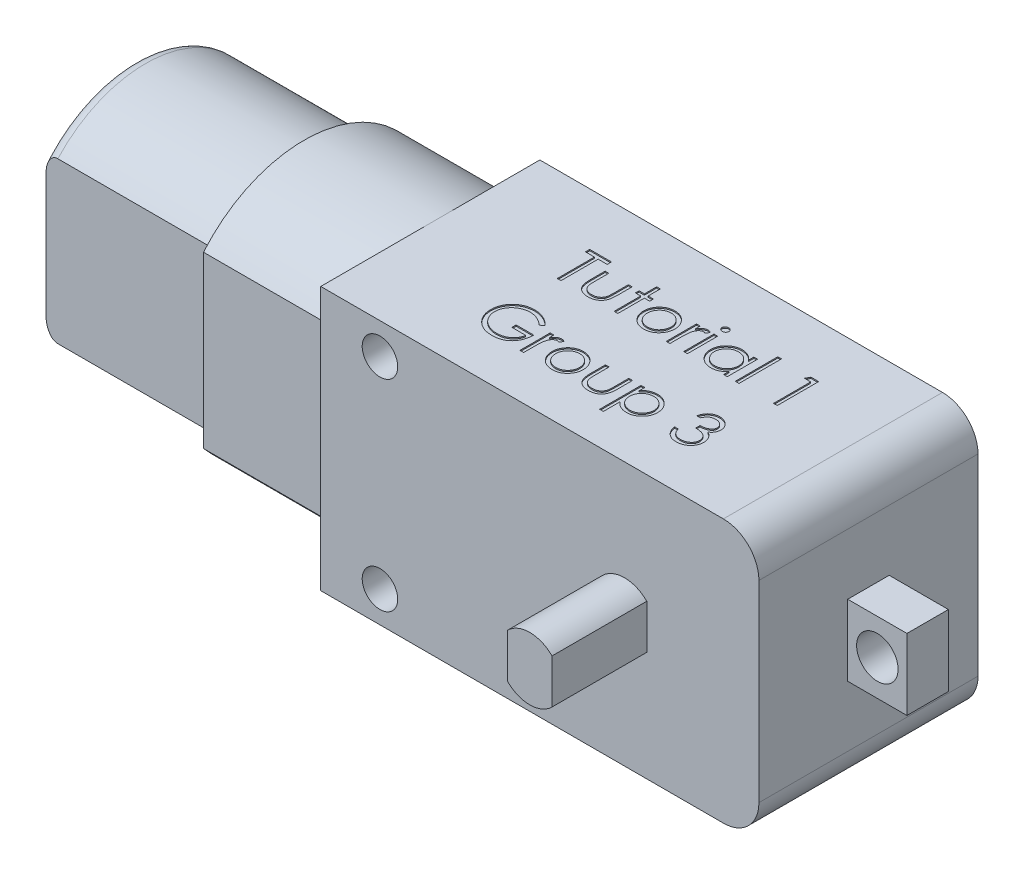
from build123d import *

# Parameters (mm, degrees)
BOSS_EXTRUDE3_DEPTH       = 9.25
BOSS_EXTRUDE3_DEPTH_BACK  = 9.25
BOSS_EXTRUDE4_DEPTH       = 11.4
BOSS_EXTRUDE5_DEPTH       = 8.8
BOSS_EXTRUDE6_DEPTH       = 5.6
FILLET1_R                 = 1
BOSS_EXTRUDE7_DEPTH       = 1
SKETCH11_R                = 1
BOSS_EXTRUDE8_DEPTH       = 1
SKETCH12_R                = 1.5
CUT_EXTRUDE1_DEPTH        = 30
BOSS_EXTRUDE11_DEPTH      = 8
BOSS_EXTRUDE11_DEPTH_BACK = 26.5
SKETCH13_R                = 2.65
SKETCH15_W                = 0.77
SKETCH15_H                = 3.735291154
CUT_EXTRUDE3_DEPTH        = 8
SKETCH16_W                = 0.77
SKETCH16_H                = 3.735291154
CUT_EXTRUDE4_DEPTH        = 8
SKETCH17_W                = 3.5
SKETCH17_H                = 6
BOSS_EXTRUDE12_DEPTH      = 5
SKETCH18_R                = 1.75
CUT_EXTRUDE5_DEPTH        = 5
SKETCH19_W                = 0.314102564
SKETCH19_H                = 2.557692308
SKETCH19_H_2              = 3.58974359
CUT_EXTRUDE6_DEPTH        = 0.1


with BuildPart() as part:
    # Sketch2 → Boss-Extrude3 (new, two sides: drawn at the far end of the back side and taken through both)
    with BuildSketch(Plane.XY.offset(-BOSS_EXTRUDE3_DEPTH_BACK)):
        with BuildLine():
            Line((-18.5, 11.125), (15.5, 11.125))
            ThreePointArc((15.5, 11.125), (17.621320344, 10.246320344), (18.5, 8.125))
            Line((18.5, 8.125), (18.5, -8.125))
            ThreePointArc((18.5, -8.125), (17.621320344, -10.246320344), (15.5, -11.125))
            Line((15.5, -11.125), (-18.5, -11.125))
            Line((-18.5, -11.125), (-18.5, 11.125))
        make_face()
    extrude(amount=BOSS_EXTRUDE3_DEPTH + BOSS_EXTRUDE3_DEPTH_BACK)

    # Sketch7 → Boss-Extrude4 (add)
    with BuildSketch(Plane.ZY.offset(18.5)):
        with BuildLine():
            Line((7.75, -7.17743861), (7.75, 7.17743861))
            ThreePointArc((7.75, 7.17743861), (-0.75, 11.125), (-9.25, 7.17743861))
            Line((-9.25, 7.17743861), (-9.25, -7.17743861))
            ThreePointArc((-9.25, -7.17743861), (-0.75, -11.125), (7.75, -7.17743861))
        make_face()
    extrude(amount=BOSS_EXTRUDE4_DEPTH)

    # Sketch8 → Boss-Extrude5 (add)
    with BuildSketch(Plane.ZY.offset(29.9)):
        with BuildLine():
            Line((6.65, -6.763181574), (6.65, 6.763181574))
            ThreePointArc((6.65, 6.763181574), (-0.75, 10.025), (-8.15, 6.763181574))
            Line((-8.15, 6.763181574), (-8.15, -6.763181574))
            ThreePointArc((-8.15, -6.763181574), (-0.75, -10.025), (6.65, -6.763181574))
        make_face()
    extrude(amount=BOSS_EXTRUDE5_DEPTH)

    # Sketch9 → Boss-Extrude6 (add)
    with BuildSketch(Plane.ZY.offset(38.7)):
        with BuildLine():
            Line((-8.15, 6.763181574), (-8.15, -6.763181574))
            ThreePointArc((-8.15, -6.763181574), (-0.75, -10.025), (6.65, -6.763181574))
            Line((6.65, -6.763181574), (6.65, 6.763181574))
            ThreePointArc((6.65, 6.763181574), (-0.75, 10.025), (-8.15, 6.763181574))
        make_face()
    extrude(amount=BOSS_EXTRUDE6_DEPTH)

    # Fillet1
    fillet1_edges = [part.edges().sort_by_distance(p)[0] for p in [
        (-44.3, -10.025, -0.75),
        (-44.3, 10.025, -0.75),
    ]]
    fillet(fillet1_edges, radius=FILLET1_R)

    # Sketch10 → Boss-Extrude7 (add)
    with BuildSketch(Plane.ZY.offset(44.3)):
        with BuildLine():
            Line((2.65, 3.666060556), (2.65, -3.666060556))
            ThreePointArc((2.65, -3.666060556), (-5.75, 0), (2.65, 3.666060556))
        make_face()
    extrude(amount=BOSS_EXTRUDE7_DEPTH)

    # Sketch11 → Boss-Extrude8 (add)
    with BuildSketch(Plane.ZY.offset(45.3)):
        with Locations((-0.75, 0)):
            Circle(SKETCH11_R)
    extrude(amount=BOSS_EXTRUDE8_DEPTH)

    # Sketch12 → Cut-Extrude1 (cut)
    with BuildSketch(Plane.XY.offset(9.25)):
        with Locations((-13.5, 8.5)):
            Circle(SKETCH12_R)
        with Locations((-13.5, -8.5)):
            Circle(SKETCH12_R)
    extrude(amount=-CUT_EXTRUDE1_DEPTH, mode=Mode.SUBTRACT)

    # Sketch13 → Boss-Extrude11 (add, two sides: drawn at the far end of the back side and taken through both)
    with BuildSketch(Plane.XY.offset(9.25).offset(-BOSS_EXTRUDE11_DEPTH_BACK)):
        with Locations((7.15, 0)):
            Circle(SKETCH13_R)
    extrude(amount=BOSS_EXTRUDE11_DEPTH + BOSS_EXTRUDE11_DEPTH_BACK)

    # Sketch15 → Cut-Extrude3 (cut)
    with BuildSketch(Plane.XY.offset(17.25)):
        with Locations((9.415, 0)):
            Rectangle(SKETCH15_W, SKETCH15_H)
        with Locations((4.885, 0)):
            Rectangle(SKETCH15_W, SKETCH15_H)
    extrude(amount=-CUT_EXTRUDE3_DEPTH, mode=Mode.SUBTRACT)

    # Sketch16 → Cut-Extrude4 (cut)
    with BuildSketch(Plane(origin=(0, 0, -17.25), x_dir=(-1, 0, 0), z_dir=(0, 0, -1))):
        with Locations((-4.885, 0)):
            Rectangle(SKETCH16_W, SKETCH16_H)
        with Locations((-9.415, 0)):
            Rectangle(SKETCH16_W, SKETCH16_H)
    extrude(amount=-CUT_EXTRUDE4_DEPTH, mode=Mode.SUBTRACT)

    # Sketch17 → Boss-Extrude12 (add)
    with BuildSketch(Plane(origin=(18.5, 0, 0), x_dir=(0, 0, -1), z_dir=(1, 0, 0))):
        Rectangle(SKETCH17_W, SKETCH17_H)
    extrude(amount=BOSS_EXTRUDE12_DEPTH)

    # Sketch18 → Cut-Extrude5 (cut)
    with BuildSketch(Plane.XY.offset(1.75)):
        with Locations((21, 0)):
            Circle(SKETCH18_R)
    extrude(amount=-CUT_EXTRUDE5_DEPTH, mode=Mode.SUBTRACT)

    # Sketch19 → Cut-Extrude6 (cut)
    # profile 1 of 16: a face of its own
    with BuildSketch(Plane(origin=(0, 11.125, 0), x_dir=(1, 0, 0), z_dir=(0, 1, 0))):
        Polygon((-9.857280915, 4.456208627), (-9.857280915, 4.815182986), (-8.017537325, 4.815182986), (-8.017537325, 4.456208627), (-8.780357838, 4.456208627), (-8.780357838, 1.315182986), (-9.094460402, 1.315182986), (-9.094460402, 4.456208627), align=None)
    # profile 2 of 16: a face of its own
    with BuildSketch(Plane(origin=(0, 11.125, 0), x_dir=(1, 0, 0), z_dir=(0, 1, 0))):
        with BuildLine():
            Line((-7.613691172, 3.872875294), (-7.299588607, 3.872875294))
            Line((-7.299588607, 3.872875294), (-7.299588607, 2.686577217))
            add(Edge.make_bspline(
                [(-7.299588607, 2.686577217), (-7.299446703, 2.651754468), (-7.299175245, 2.58514018), (-7.297334304, 2.489284993), (-7.293004211, 2.40186828), (-7.287590386, 2.322839544), (-7.28062825, 2.252212152), (-7.272344889, 2.190232795), (-7.263086468, 2.136198611), (-7.254023754, 2.103655255), (-7.24980896, 2.088520326)],
                knots=[0, 0, 0, 0, 1.388932606, 2.656963016, 3.823490214, 4.879454478, 5.816252168, 6.653371382, 7.373723809, 8, 8, 8, 8], degree=3))
            add(Edge.make_bspline(
                [(-7.24980896, 2.088520326), (-7.243047505, 2.069497455), (-7.229665164, 2.031847194), (-7.20539168, 1.977458189), (-7.175363344, 1.927082906), (-7.142503516, 1.878778834), (-7.104604108, 1.833976847), (-7.062144637, 1.792752603), (-7.0165464, 1.753548512), (-6.948791377, 1.70716372), (-6.856132111, 1.65744839), (-6.734479355, 1.614552571), (-6.602575129, 1.588916751), (-6.51141041, 1.585942496), (-6.46455255, 1.584413756)],
                knots=[0, 0, 0, 0, 0.725840625, 1.436591201, 2.137033971, 2.831655856, 3.53531722, 4.242432219, 4.957935707, 5.694543706, 7.190802206, 8.724350549, 10.316345118, 12, 12, 12, 12], degree=3))
            add(Edge.make_bspline(
                [(-6.46455255, 1.584413756), (-6.417699042, 1.585975004), (-6.327046174, 1.588995731), (-6.196591204, 1.61377927), (-6.07733979, 1.655184959), (-5.970488839, 1.712992371), (-5.876522999, 1.783734434), (-5.79821858, 1.866743242), (-5.733611325, 1.959392629), (-5.705401905, 2.028516908), (-5.69121521, 2.063279941)],
                knots=[0, 0, 0, 0, 1.157059328, 2.238695713, 3.266970494, 4.264342957, 5.228770407, 6.160125903, 7.074715775, 8, 8, 8, 8], degree=3))
            add(Edge.make_bspline(
                [(-5.69121521, 2.063279941), (-5.68702098, 2.07724624), (-5.677748562, 2.108122316), (-5.66778621, 2.160502064), (-5.658811749, 2.222966668), (-5.651148572, 2.295924877), (-5.64568341, 2.37918603), (-5.642737383, 2.472724106), (-5.639409108, 2.576245466), (-5.639358592, 2.648713225), (-5.639332197, 2.686577217)],
                knots=[0, 0, 0, 0, 0.557542046, 1.232589297, 2.036731608, 2.971723315, 4.038036528, 5.22795436, 6.551621927, 8, 8, 8, 8], degree=3))
            Line((-5.639332197, 2.686577217), (-5.639332197, 3.872875294))
            Line((-5.639332197, 3.872875294), (-5.325229633, 3.872875294))
            Line((-5.325229633, 3.872875294), (-5.325229633, 2.627682986))
            add(Edge.make_bspline(
                [(-5.325229633, 2.627682986), (-5.325671328, 2.585375815), (-5.326528276, 2.503294115), (-5.33203562, 2.384010003), (-5.341485232, 2.272847759), (-5.355827917, 2.169748539), (-5.372693592, 2.074791057), (-5.394449865, 1.987853611), (-5.420428103, 1.909204057), (-5.449733618, 1.83746228), (-5.484355485, 1.772415386), (-5.521182506, 1.710679569), (-5.563707278, 1.653786634), (-5.608477512, 1.598904497), (-5.658279168, 1.54876297), (-5.712179027, 1.502211494), (-5.769418447, 1.458538462), (-5.831267645, 1.419447183), (-5.896823707, 1.384230537), (-5.966167564, 1.353014459), (-6.040148563, 1.328311882), (-6.1178122, 1.307001216), (-6.199538979, 1.290286747), (-6.285250112, 1.27850018), (-6.374916728, 1.27127485), (-6.436026188, 1.270637805), (-6.467357037, 1.270311191)],
                knots=[0, 0, 0, 0, 1.493040784, 2.896703357, 4.213163133, 5.428574705, 6.569057535, 7.615249723, 8.588095153, 9.490268104, 10.346124644, 11.18633936, 12.024365274, 12.850166724, 13.684164916, 14.514361689, 15.362232829, 16.222528818, 17.093394965, 17.986930858, 18.902426812, 19.842810585, 20.827885679, 21.843828298, 22.894529745, 24, 24, 24, 24], degree=3))
            add(Edge.make_bspline(
                [(-6.467357037, 1.270311191), (-6.498453551, 1.270650899), (-6.559561096, 1.271318455), (-6.64923234, 1.278460262), (-6.735180947, 1.290268433), (-6.817101345, 1.307123651), (-6.895075743, 1.32816272), (-6.969419982, 1.353166256), (-7.039263545, 1.384246738), (-7.105445549, 1.419224295), (-7.167447938, 1.458789571), (-7.225556516, 1.50215761), (-7.279693368, 1.549263673), (-7.329870436, 1.59991103), (-7.375383413, 1.654727967), (-7.416799454, 1.713273527), (-7.45475616, 1.774967616), (-7.48910895, 1.841030778), (-7.518620706, 1.913602788), (-7.544675951, 1.993899885), (-7.56598659, 2.082802402), (-7.583329058, 2.18023433), (-7.597280499, 2.285729372), (-7.606966641, 2.399897787), (-7.612382472, 2.522461479), (-7.613245533, 2.607111369), (-7.613691172, 2.650820006)],
                knots=[0, 0, 0, 0, 1.083640291, 2.129454052, 3.13281866, 4.105697902, 5.042300162, 5.946461698, 6.836384745, 7.703652036, 8.553297018, 9.397182691, 10.228592656, 11.052265423, 11.879314572, 12.708807002, 13.549817954, 14.402308542, 15.300838682, 16.27712199, 17.341985831, 18.484375296, 19.725102775, 21.0496083, 22.476576903, 24, 24, 24, 24], degree=3))
            Line((-7.613691172, 2.650820006), (-7.613691172, 3.872875294))
        make_face()
    # profile 3 of 16: a face of its own
    with BuildSketch(Plane(origin=(0, 11.125, 0), x_dir=(1, 0, 0), z_dir=(0, 1, 0))):
        Polygon((-4.293178351, 4.904926576), (-3.979075787, 4.904926576), (-3.979075787, 3.872875294), (-3.530357838, 3.872875294), (-3.530357838, 3.55877273), (-3.979075787, 3.55877273), (-3.979075787, 1.315182986), (-4.293178351, 1.315182986), (-4.293178351, 3.55877273), (-4.7418963, 3.55877273), (-4.7418963, 3.872875294), (-4.293178351, 3.872875294), align=None)
    # profile 4 of 16: a face of its own
    with BuildSketch(Plane(origin=(0, 11.125, 0), x_dir=(1, 0, 0), z_dir=(0, 1, 0))):
        with BuildLine():
            add(Edge.make_bspline(
                [(-1.756519697, 3.917747089), (-1.708528424, 3.916725198), (-1.614429267, 3.914721519), (-1.476621381, 3.893306553), (-1.345076245, 3.860559189), (-1.219290053, 3.815287627), (-1.100873757, 3.754605676), (-0.988102513, 3.682196385), (-0.881285504, 3.596413792), (-0.817262475, 3.530055723), (-0.78476489, 3.49637289)],
                knots=[0, 0, 0, 0, 1.054011418, 2.066658804, 3.057071809, 4.030435133, 4.997543892, 5.974964718, 6.972108034, 8, 8, 8, 8], degree=3))
            add(Edge.make_bspline(
                [(-0.78476489, 3.49637289), (-0.756782935, 3.464158904), (-0.701360555, 3.400354362), (-0.630294836, 3.296898749), (-0.569073276, 3.189758649), (-0.520010315, 3.077511322), (-0.481325292, 2.961136651), (-0.453859595, 2.84023464), (-0.43752266, 2.715072292), (-0.435319693, 2.630068454), (-0.434203992, 2.587017922)],
                knots=[0, 0, 0, 0, 1.025258237, 2.030674902, 3.01204498, 3.988269485, 4.97094183, 5.956517959, 6.965070386, 8, 8, 8, 8], degree=3))
            add(Edge.make_bspline(
                [(-0.434203992, 2.587017922), (-0.435185329, 2.543717865), (-0.437124498, 2.458154931), (-0.455468114, 2.332135565), (-0.4839992, 2.209940743), (-0.524831038, 2.092082049), (-0.577189147, 1.978199222), (-0.641079835, 1.868789672), (-0.716951452, 1.763637539), (-0.802955449, 1.663635701), (-0.898007325, 1.571469486), (-1.001123473, 1.491141216), (-1.110277507, 1.422319692), (-1.22692086, 1.366883276), (-1.349988347, 1.323173576), (-1.479745415, 1.29247356), (-1.615990486, 1.273911876), (-1.709017707, 1.271528303), (-1.756519697, 1.270311191)],
                knots=[0, 0, 0, 0, 0.998656419, 1.973391657, 2.932242238, 3.890759089, 4.846373663, 5.82037756, 6.809684879, 7.83454468, 8.860553229, 9.859544525, 10.845671541, 11.83227036, 12.833544569, 13.85385346, 14.904124723, 16, 16, 16, 16], degree=3))
            add(Edge.make_bspline(
                [(-1.756519697, 1.270311191), (-1.804254417, 1.271532388), (-1.897745276, 1.273924162), (-2.034471258, 1.292401445), (-2.164460877, 1.323159427), (-2.287689476, 1.36702692), (-2.404834323, 1.422321464), (-2.51462082, 1.490933154), (-2.617820735, 1.571493309), (-2.71289272, 1.663629246), (-2.798891325, 1.763639202), (-2.874764333, 1.868789241), (-2.938654659, 1.978199334), (-2.991012863, 2.092082019), (-3.031844676, 2.209940751), (-3.060375769, 2.332135563), (-3.078719384, 2.458154932), (-3.080658552, 2.543717865), (-3.08163989, 2.587017922)],
                knots=[0, 0, 0, 0, 1.099876186, 2.154163076, 3.173186993, 4.173200201, 5.163417411, 6.152872554, 7.150605724, 8.17532212, 9.198891216, 10.186952605, 11.159729845, 12.11414092, 13.071450619, 14.029093627, 15.002601286, 16, 16, 16, 16], degree=3))
            add(Edge.make_bspline(
                [(-3.08163989, 2.587017922), (-3.080516579, 2.629834468), (-3.078292618, 2.714603871), (-3.061972109, 2.839530931), (-3.034613552, 2.96022832), (-2.995882156, 3.076153796), (-2.946366965, 3.187909232), (-2.886005677, 3.295314063), (-2.814215044, 3.398301864), (-2.759013093, 3.462023944), (-2.731078992, 3.494269525)],
                knots=[0, 0, 0, 0, 1.031353054, 2.041901799, 3.029428768, 4.008703097, 4.981709435, 5.96992636, 6.972712378, 8, 8, 8, 8], degree=3))
            add(Edge.make_bspline(
                [(-2.731078992, 3.494269525), (-2.698630401, 3.528244464), (-2.634814537, 3.59506216), (-2.527465809, 3.680594684), (-2.414971988, 3.754510758), (-2.295247062, 3.813986974), (-2.169564204, 3.860825491), (-2.037344962, 3.893391006), (-1.899069446, 3.914644361), (-1.804509825, 3.916702539), (-1.756519697, 3.917747089)],
                knots=[0, 0, 0, 0, 1.027980169, 2.021703884, 2.998553061, 3.971491411, 4.943284454, 5.930300938, 6.949603206, 8, 8, 8, 8], degree=3))
        make_face()
        with BuildLine():
            add(Edge.make_bspline(
                [(-1.757921941, 3.603644525), (-1.791859552, 3.602679933), (-1.858858681, 3.600775651), (-1.957478265, 3.586291746), (-2.052418419, 3.563344242), (-2.143859264, 3.530740186), (-2.231492436, 3.488641287), (-2.315401838, 3.436932926), (-2.395834278, 3.37629997), (-2.471216342, 3.306837298), (-2.540398654, 3.230958304), (-2.60087663, 3.150109945), (-2.652301737, 3.065603599), (-2.695141896, 2.977351387), (-2.727049084, 2.884458974), (-2.750222106, 2.787978342), (-2.764692347, 2.687712926), (-2.766578725, 2.619551908), (-2.767537325, 2.584914557)],
                knots=[0, 0, 0, 0, 1.021534396, 2.016698045, 2.994645724, 3.958388632, 4.93408049, 5.916473867, 6.921342795, 7.962252576, 8.998418191, 10.008913653, 10.997312074, 11.973003931, 12.956656626, 13.948281152, 14.957379055, 16, 16, 16, 16], degree=3))
            add(Edge.make_bspline(
                [(-2.767537325, 2.584914557), (-2.765930502, 2.54016253), (-2.762741257, 2.451338124), (-2.736806021, 2.320527002), (-2.693419741, 2.194945149), (-2.634832461, 2.075328763), (-2.561426243, 1.964656485), (-2.474939176, 1.865985001), (-2.376299476, 1.78079919), (-2.266682975, 1.710118344), (-2.148328657, 1.653958588), (-2.023072336, 1.614159613), (-1.892431642, 1.58828792), (-1.803150911, 1.585716446), (-1.757921941, 1.584413756)],
                knots=[0, 0, 0, 0, 1.016792936, 2.018143844, 3.017858371, 4.030088057, 5.03801393, 6.028138512, 7.003788237, 7.991172063, 8.984598303, 9.972568034, 10.972917682, 12, 12, 12, 12], degree=3))
            add(Edge.make_bspline(
                [(-1.757921941, 1.584413756), (-1.712695572, 1.585724036), (-1.623419976, 1.588310493), (-1.492960799, 1.614029312), (-1.368046827, 1.654132973), (-1.24981544, 1.710055183), (-1.140248836, 1.781067598), (-1.040899715, 1.865503975), (-0.955151104, 1.964917826), (-0.881817499, 2.075475355), (-0.822270756, 2.194759707), (-0.779087554, 2.320550179), (-0.753089968, 2.451332221), (-0.74990914, 2.540160552), (-0.748306556, 2.584914557)],
                knots=[0, 0, 0, 0, 1.02726834, 2.027799167, 3.010890988, 4.004497153, 4.992059811, 5.971914811, 6.958719428, 7.966827853, 8.981595046, 9.981490638, 10.983022906, 12, 12, 12, 12], degree=3))
            add(Edge.make_bspline(
                [(-0.748306556, 2.584914557), (-0.749264826, 2.619552115), (-0.751150555, 2.68771354), (-0.76562552, 2.787975994), (-0.788781059, 2.88446759), (-0.820752677, 2.977319594), (-0.86340669, 3.065832098), (-0.915823484, 3.149861825), (-0.976054509, 3.231238371), (-1.04607163, 3.306592012), (-1.121375008, 3.376327049), (-1.201840046, 3.436956438), (-1.285625024, 3.488414033), (-1.373003607, 3.531100274), (-1.464456175, 3.563047614), (-1.559263304, 3.586424246), (-1.657462114, 3.600714442), (-1.724221157, 3.602661584), (-1.757921941, 3.603644525)],
                knots=[0, 0, 0, 0, 1.042956736, 2.052379634, 3.044323526, 4.02829302, 5.004299113, 5.996692471, 7.007513377, 8.048758398, 9.090003419, 10.095195979, 11.07790575, 12.047570684, 13.018257071, 13.989683339, 14.985167495, 16, 16, 16, 16], degree=3))
        make_face(mode=Mode.SUBTRACT)
    # profile 5 of 16: a face of its own
    with BuildSketch(Plane(origin=(0, 11.125, 0), x_dir=(1, 0, 0), z_dir=(0, 1, 0))):
        with BuildLine():
            Line((0.104257546, 3.872875294), (0.41836011, 3.872875294))
            Line((0.41836011, 3.872875294), (0.41836011, 3.49637289))
            add(Edge.make_bspline(
                [(0.41836011, 3.49637289), (0.441548869, 3.531428718), (0.48589719, 3.598472718), (0.55961012, 3.687142019), (0.635113451, 3.760557065), (0.712768638, 3.819060584), (0.793146738, 3.862873703), (0.87448369, 3.894966738), (0.95805916, 3.913944053), (1.014221084, 3.916477712), (1.042358508, 3.917747089)],
                knots=[0, 0, 0, 0, 1.2804753, 2.448899062, 3.506932113, 4.484331642, 5.4025378, 6.288909075, 7.142734305, 8, 8, 8, 8], degree=3))
            add(Edge.make_bspline(
                [(1.042358508, 3.917747089), (1.064184834, 3.916556562), (1.10909392, 3.914106976), (1.177076509, 3.896896152), (1.247119961, 3.869418129), (1.292262349, 3.843577907), (1.315796008, 3.830106865)],
                knots=[0, 0, 0, 0, 0.901110191, 1.854092781, 2.881294221, 4, 4, 4, 4], degree=3))
            Line((1.315796008, 3.830106865), (1.143320046, 3.558071608))
            add(Edge.make_bspline(
                [(1.143320046, 3.558071608), (1.128211025, 3.564811874), (1.099531211, 3.57760619), (1.057576644, 3.5927482), (1.018895308, 3.601664116), (0.994251749, 3.603014833), (0.982763155, 3.603644525)],
                knots=[0, 0, 0, 0, 1.180555205, 2.24091978, 3.179933427, 4, 4, 4, 4], degree=3))
            add(Edge.make_bspline(
                [(0.982763155, 3.603644525), (0.957557422, 3.601964487), (0.906145032, 3.598537698), (0.830660532, 3.57159889), (0.757413327, 3.52807365), (0.699241665, 3.479802538), (0.654199412, 3.433254741), (0.622059186, 3.392606338), (0.592576439, 3.347027707), (0.564406219, 3.297298023), (0.538739925, 3.242568177), (0.514785255, 3.183384964), (0.493126393, 3.119679835), (0.480776148, 3.075297315), (0.474449854, 3.052562794)],
                knots=[0, 0, 0, 0, 1.125678352, 2.296057538, 3.5422874, 4.923748041, 5.663163013, 6.437101912, 7.23742474, 8.08941207, 8.991984279, 9.93940061, 10.944477711, 12, 12, 12, 12], degree=3))
            add(Edge.make_bspline(
                [(0.474449854, 3.052562794), (0.469717461, 3.03228562), (0.459235569, 2.987373222), (0.449044031, 2.912024697), (0.438974513, 2.823001038), (0.431877895, 2.720054445), (0.425299853, 2.603442002), (0.42158977, 2.472986056), (0.41848663, 2.328552705), (0.418403563, 2.227578352), (0.41836011, 2.174758307)],
                knots=[0, 0, 0, 0, 0.566838948, 1.255505196, 2.06880316, 3.007127437, 4.065329342, 5.249902469, 6.561414163, 8, 8, 8, 8], degree=3))
            Line((0.41836011, 2.174758307), (0.41836011, 1.315182986))
            Line((0.41836011, 1.315182986), (0.104257546, 1.315182986))
            Line((0.104257546, 1.315182986), (0.104257546, 3.872875294))
        make_face()
    # profile 6 of 16: a face of its own
    with BuildSketch(Plane(origin=(0, 11.125, 0), x_dir=(1, 0, 0), z_dir=(0, 1, 0))):
        with BuildLine():
            add(Edge.make_bspline(
                [(1.740675816, 4.949798371), (1.760167131, 4.948894219), (1.798334871, 4.947123715), (1.853528139, 4.931962237), (1.903785151, 4.906262552), (1.948362884, 4.871782871), (1.986614771, 4.831233428), (2.013395481, 4.783972459), (2.030607877, 4.732913821), (2.032686432, 4.697298731), (2.033744726, 4.679165358)],
                knots=[0, 0, 0, 0, 1.055194115, 2.066272739, 3.074728998, 4.095836921, 5.109056067, 6.073838105, 7.019297344, 8, 8, 8, 8], degree=3))
            add(Edge.make_bspline(
                [(2.033744726, 4.679165358), (2.032662566, 4.661502705), (2.030523264, 4.62658573), (2.013408776, 4.576412258), (1.986386538, 4.529807974), (1.948387412, 4.489337264), (1.903778651, 4.454876644), (1.853529866, 4.429171905), (1.798334417, 4.414011768), (1.760166978, 4.412241079), (1.740675816, 4.411336832)],
                knots=[0, 0, 0, 0, 0.96129708, 1.900370562, 2.859976407, 3.87933698, 4.906634145, 5.921202961, 6.938410037, 8, 8, 8, 8], degree=3))
            add(Edge.make_bspline(
                [(1.740675816, 4.411336832), (1.72140754, 4.412206553), (1.68390436, 4.413899349), (1.629537518, 4.429469367), (1.579709029, 4.45488544), (1.535044356, 4.489111625), (1.497814163, 4.530056523), (1.470715837, 4.576383817), (1.453640875, 4.626592971), (1.451496247, 4.661505137), (1.450411393, 4.679165358)],
                knots=[0, 0, 0, 0, 1.054934014, 2.053291228, 3.073705704, 4.106921865, 5.123545215, 6.088680038, 7.033164197, 8, 8, 8, 8], degree=3))
            add(Edge.make_bspline(
                [(1.450411393, 4.679165358), (1.451472479, 4.697296208), (1.45355652, 4.73290634), (1.470728636, 4.784001373), (1.497588444, 4.830982875), (1.535069008, 4.872008374), (1.579702468, 4.906253809), (1.629539213, 4.931664791), (1.683903912, 4.94723613), (1.721407388, 4.948928744), (1.740675816, 4.949798371)],
                knots=[0, 0, 0, 0, 0.98631895, 1.937192651, 2.907499808, 3.917963147, 4.944918757, 5.95915025, 6.951458133, 8, 8, 8, 8], degree=3))
        make_face()
    # profile 7 of 16: a face of its own
    with BuildSketch(Plane(origin=(0, 11.125, 0), x_dir=(1, 0, 0), z_dir=(0, 1, 0))):
        with Locations((1.742078059, 2.59402914)):
            Rectangle(SKETCH19_W, SKETCH19_H)
    # profile 8 of 16: a face of its own
    with BuildSketch(Plane(origin=(0, 11.125, 0), x_dir=(1, 0, 0), z_dir=(0, 1, 0))):
        with BuildLine():
            Line((5.264513957, 3.872875294), (5.264513957, 1.315182986))
            Line((5.264513957, 1.315182986), (4.950411393, 1.315182986))
            Line((4.950411393, 1.315182986), (4.950411393, 1.757590839))
            add(Edge.make_bspline(
                [(4.950411393, 1.757590839), (4.914992602, 1.717551245), (4.845872387, 1.639413474), (4.730431269, 1.537331301), (4.608063091, 1.45295298), (4.47936177, 1.384803064), (4.344443526, 1.333611008), (4.203607439, 1.297224849), (4.056796058, 1.273831013), (3.956543703, 1.271494992), (3.905739918, 1.270311191)],
                knots=[0, 0, 0, 0, 1.074387032, 2.096679803, 3.090159297, 4.057316773, 5.018401886, 5.985159533, 6.978961417, 8, 8, 8, 8], degree=3))
            add(Edge.make_bspline(
                [(3.905739918, 1.270311191), (3.860571964, 1.271537564), (3.771498759, 1.273956024), (3.640469682, 1.292718328), (3.514377433, 1.322848949), (3.39310286, 1.364749839), (3.277430715, 1.420330661), (3.166370618, 1.486871909), (3.060497926, 1.566112739), (2.961426387, 1.656700767), (2.870194387, 1.755095754), (2.790133114, 1.860041301), (2.723380034, 1.971083605), (2.667559954, 2.086816759), (2.624563609, 2.208131678), (2.594589975, 2.334608846), (2.575849528, 2.46609872), (2.573432067, 2.555638243), (2.572206264, 2.601040358)],
                knots=[0, 0, 0, 0, 1.033919861, 2.038935746, 3.024066025, 3.998881131, 4.97069526, 5.957263378, 6.95902576, 7.993208707, 9.027059324, 10.027763471, 11.009749337, 11.988697705, 12.965288445, 13.950418724, 14.960734635, 16, 16, 16, 16], degree=3))
            add(Edge.make_bspline(
                [(2.572206264, 2.601040358), (2.573459236, 2.645504062), (2.575936293, 2.733406405), (2.594389512, 2.862685103), (2.625420521, 2.987203364), (2.668968369, 3.106560307), (2.724810324, 3.220900357), (2.792738411, 3.330304382), (2.872757535, 3.43507378), (2.965009942, 3.532745006), (3.064944713, 3.622965621), (3.171853444, 3.701374666), (3.283076725, 3.769091515), (3.400339735, 3.822744991), (3.52190684, 3.866154096), (3.648860286, 3.896187064), (3.780671865, 3.913884385), (3.870162357, 3.916447149), (3.915555623, 3.917747089)],
                knots=[0, 0, 0, 0, 1.020392517, 2.01726096, 2.990465484, 3.961182959, 4.928053699, 5.906110375, 6.912531644, 7.948652711, 8.985773172, 9.998621852, 10.987621588, 11.969261332, 12.953316658, 13.946091881, 14.958173133, 16, 16, 16, 16], degree=3))
            add(Edge.make_bspline(
                [(3.915555623, 3.917747089), (3.967755482, 3.916309337), (4.070116942, 3.913489974), (4.219844952, 3.890027247), (4.36148943, 3.85038878), (4.496143782, 3.796471282), (4.623324468, 3.724822553), (4.741827452, 3.634442592), (4.852892935, 3.525901405), (4.917273227, 3.44253096), (4.950411393, 3.399618082)],
                knots=[0, 0, 0, 0, 1.038897134, 2.037228247, 3.008116434, 3.962042015, 4.918381754, 5.904844433, 6.921570401, 8, 8, 8, 8], degree=3))
            Line((4.950411393, 3.399618082), (4.950411393, 3.872875294))
            Line((4.950411393, 3.872875294), (5.264513957, 3.872875294))
        make_face()
        with BuildLine():
            add(Edge.make_bspline(
                [(3.919762354, 3.603644525), (3.873848016, 3.602010887), (3.783220416, 3.598786346), (3.650176414, 3.573612851), (3.522863, 3.531728256), (3.401916926, 3.474446355), (3.289248709, 3.402417619), (3.188555038, 3.315296235), (3.099012337, 3.215459221), (3.023704073, 3.103357111), (2.962313576, 2.98317902), (2.919146544, 2.857554582), (2.890677297, 2.728749604), (2.887768776, 2.641386918), (2.886308828, 2.597534749)],
                knots=[0, 0, 0, 0, 1.031046209, 2.035121221, 3.029706178, 4.034933723, 5.034054252, 6.02443088, 7.017295772, 8.038157696, 9.050218397, 10.03989886, 11.016116709, 12, 12, 12, 12], degree=3))
            add(Edge.make_bspline(
                [(2.886308828, 2.597534749), (2.888173722, 2.553944642), (2.891896199, 2.466935286), (2.918646893, 2.337954709), (2.963526766, 2.212300667), (3.024768829, 2.091039674), (3.101455454, 1.978455573), (3.190344106, 1.876715451), (3.292294388, 1.789225863), (3.405221895, 1.715988289), (3.525829865, 1.656825768), (3.652663797, 1.615660129), (3.783339435, 1.589082348), (3.872191769, 1.585977871), (3.916957867, 1.584413756)],
                knots=[0, 0, 0, 0, 0.979072187, 1.954306742, 2.945804271, 3.96968567, 4.997920485, 5.998718438, 6.996577872, 8.005894225, 9.015743152, 10.005417472, 10.995077863, 12, 12, 12, 12], degree=3))
            add(Edge.make_bspline(
                [(3.916957867, 1.584413756), (3.96240437, 1.586073719), (4.052792956, 1.589375223), (4.186231664, 1.614656488), (4.315726627, 1.656425287), (4.439513855, 1.714324413), (4.554829986, 1.786081769), (4.658327864, 1.87008886), (4.745843832, 1.967792045), (4.820036442, 2.075168498), (4.878211859, 2.192880494), (4.920587918, 2.318214685), (4.945641824, 2.451175433), (4.948799553, 2.54203936), (4.950411393, 2.588420166)],
                knots=[0, 0, 0, 0, 1.01762866, 2.023962475, 3.030623092, 4.058876274, 5.077231937, 6.066672613, 7.034107872, 8.005628644, 8.981990164, 9.965428785, 10.961468474, 12, 12, 12, 12], degree=3))
            add(Edge.make_bspline(
                [(4.950411393, 2.588420166), (4.949451736, 2.623757996), (4.947562829, 2.69331403), (4.933132259, 2.795441547), (4.910177333, 2.893175273), (4.877831163, 2.986617962), (4.835339878, 3.075252978), (4.784092112, 3.159716738), (4.723186663, 3.239569949), (4.653603967, 3.31371302), (4.577438764, 3.381339483), (4.496844223, 3.441703723), (4.410865477, 3.491292496), (4.32094844, 3.532333768), (4.226937105, 3.564992917), (4.128066485, 3.586780611), (4.025387498, 3.601740932), (3.955341443, 3.603003313), (3.919762354, 3.603644525)],
                knots=[0, 0, 0, 0, 1.050140795, 2.067009409, 3.05949893, 4.030605086, 5.00011959, 5.97591094, 6.962425594, 7.979863591, 8.993523472, 9.986985069, 10.967611495, 11.937549037, 12.921786183, 13.919465291, 14.943216303, 16, 16, 16, 16], degree=3))
        make_face(mode=Mode.SUBTRACT)
    # profile 9 of 16: a face of its own
    with BuildSketch(Plane(origin=(0, 11.125, 0), x_dir=(1, 0, 0), z_dir=(0, 1, 0))):
        with Locations((6.094642162, 3.110054781)):
            Rectangle(SKETCH19_W, SKETCH19_H_2)
    # profile 10 of 16: a face of its own
    with BuildSketch(Plane(origin=(0, 11.125, 0), x_dir=(1, 0, 0), z_dir=(0, 1, 0))):
        Polygon((8.835327258, 4.815182986), (9.482462675, 4.815182986), (9.482462675, 1.315182986), (9.16836011, 1.315182986), (9.16836011, 4.456208627), (8.629898572, 4.456208627), align=None)
    # profile 11 of 16: a face of its own
    with BuildSketch(Plane(origin=(0, 11.125, 0), x_dir=(1, 0, 0), z_dir=(0, 1, 0))):
        with BuildLine():
            Line((-6.177793736, -2.615506116), (-6.447024505, -2.87071445))
            add(Edge.make_bspline(
                [(-6.447024505, -2.87071445), (-6.495743393, -2.824883587), (-6.59201944, -2.734314724), (-6.748979682, -2.616803729), (-6.912743316, -2.516137628), (-7.082455813, -2.434231392), (-7.253914367, -2.368878631), (-7.424843143, -2.322350491), (-7.593488845, -2.292677954), (-7.705656063, -2.289129584), (-7.760926748, -2.287381116)],
                knots=[0, 0, 0, 0, 1.08915593, 2.152340314, 3.188132944, 4.216796309, 5.218260357, 6.173443236, 7.099959455, 8, 8, 8, 8], degree=3))
            add(Edge.make_bspline(
                [(-7.760926748, -2.287381116), (-7.794841448, -2.287794722), (-7.862582889, -2.288620861), (-7.963204833, -2.299165076), (-8.06277147, -2.314329941), (-8.161094845, -2.336271818), (-8.258366131, -2.364080878), (-8.354247023, -2.398866341), (-8.448916378, -2.439421585), (-8.541482459, -2.486284059), (-8.631222963, -2.537763905), (-8.715979798, -2.594812446), (-8.796293197, -2.655601236), (-8.870653623, -2.721652215), (-8.939488809, -2.792367081), (-9.004437181, -2.866430387), (-9.063214477, -2.945865605), (-9.116305642, -3.029211231), (-9.16366726, -3.115003421), (-9.205475914, -3.20241641), (-9.240573002, -3.291160265), (-9.268342457, -3.381346342), (-9.291253111, -3.472276932), (-9.307370718, -3.564581653), (-9.316457441, -3.658359338), (-9.318029221, -3.721156597), (-9.318819377, -3.752725668)],
                knots=[0, 0, 0, 0, 1.02818874, 2.053710826, 3.065248034, 4.081641283, 5.106893873, 6.131558223, 7.173050175, 8.228653731, 9.27666206, 10.308777013, 11.325269123, 12.329503258, 13.32196095, 14.316845687, 15.314881793, 16.315733098, 17.311955233, 18.285320748, 19.252783886, 20.203351036, 21.145449891, 22.095197417, 23.042428769, 24, 24, 24, 24], degree=3))
            add(Edge.make_bspline(
                [(-9.318819377, -3.752725668), (-9.318063658, -3.784996485), (-9.316554285, -3.849449998), (-9.306893966, -3.945644071), (-9.288965725, -4.040409473), (-9.264998017, -4.134057606), (-9.235017201, -4.226748854), (-9.197644535, -4.318081364), (-9.153378934, -4.408051755), (-9.102142382, -4.495849372), (-9.045956179, -4.581372396), (-8.983013098, -4.661931917), (-8.916152514, -4.738600695), (-8.842938615, -4.809676458), (-8.765719072, -4.877060355), (-8.682186796, -4.938895877), (-8.593984336, -4.9963741), (-8.500977124, -5.048770619), (-8.404174342, -5.095579155), (-8.304917588, -5.137203051), (-8.202889773, -5.171482388), (-8.098627083, -5.199420492), (-7.992253812, -5.22232079), (-7.883230009, -5.23705327), (-7.7723573, -5.247744101), (-7.697618668, -5.248525771), (-7.65996521, -5.248919578)],
                knots=[0, 0, 0, 0, 0.93586088, 1.869166235, 2.799637598, 3.729985548, 4.670839027, 5.622275134, 6.589130586, 7.576015415, 8.568469353, 9.55398029, 10.53834874, 11.515998671, 12.510579167, 13.508179873, 14.527009472, 15.561807829, 16.601455013, 17.643573243, 18.680854198, 19.719860599, 20.772568776, 21.833555941, 22.908541556, 24, 24, 24, 24], degree=3))
            add(Edge.make_bspline(
                [(-7.65996521, -5.248919578), (-7.614586863, -5.247971001), (-7.525479106, -5.246108318), (-7.394492663, -5.231608028), (-7.268689592, -5.208961235), (-7.148423389, -5.175795338), (-7.033554368, -5.133491663), (-6.923661427, -5.082496277), (-6.819609768, -5.020853217), (-6.721086595, -4.95127935), (-6.630329409, -4.873764518), (-6.548475285, -4.790120063), (-6.476829796, -4.700751996), (-6.414325097, -4.606186681), (-6.362616442, -4.505641376), (-6.320173647, -4.399608813), (-6.287640355, -4.288041301), (-6.274285381, -4.21094967), (-6.267537325, -4.171996501)],
                knots=[0, 0, 0, 0, 1.13008108, 2.219097802, 3.278683437, 4.311054135, 5.322181354, 6.324827112, 7.324222904, 8.330512327, 9.32562643, 10.293043162, 11.24128371, 12.174520618, 13.111833804, 14.052305215, 15.015860969, 16, 16, 16, 16], degree=3))
            Line((-6.267537325, -4.171996501), (-7.434203992, -4.171996501))
            Line((-7.434203992, -4.171996501), (-7.434203992, -3.813022142))
            Line((-7.434203992, -3.813022142), (-5.953434761, -3.813022142))
            add(Edge.make_bspline(
                [(-5.953434761, -3.813022142), (-5.95514061, -3.879929631), (-5.958479263, -4.010879672), (-5.981898179, -4.201849943), (-6.019714691, -4.382221637), (-6.071375003, -4.552184708), (-6.138250283, -4.711498301), (-6.219622812, -4.860324167), (-6.316794933, -4.997700848), (-6.426305374, -5.124749852), (-6.549205332, -5.238079064), (-6.682173952, -5.337685002), (-6.82543092, -5.421587617), (-6.978840728, -5.48984828), (-7.141901161, -5.543122274), (-7.314989541, -5.580893851), (-7.497871142, -5.603523814), (-7.623207819, -5.606415194), (-7.68730896, -5.607893937)],
                knots=[0, 0, 0, 0, 1.140356446, 2.231883559, 3.274166699, 4.278491846, 5.25512956, 6.21435461, 7.1637429, 8.11826594, 9.068280886, 10.0076534, 10.945064095, 11.891975133, 12.864533718, 13.863980011, 14.907571808, 16, 16, 16, 16], degree=3))
            add(Edge.make_bspline(
                [(-7.68730896, -5.607893937), (-7.726819095, -5.607324816), (-7.804745816, -5.606202325), (-7.919836744, -5.598224978), (-8.031754365, -5.585944401), (-8.140482374, -5.567399278), (-8.246420716, -5.544684624), (-8.349040301, -5.515597905), (-8.448732043, -5.481929206), (-8.545650029, -5.443633532), (-8.638914575, -5.399261875), (-8.728941092, -5.349952236), (-8.816227218, -5.295958875), (-8.900178383, -5.236348029), (-8.981232005, -5.171565569), (-9.058865448, -5.10148165), (-9.133513326, -5.026310531), (-9.18027379, -4.972931521), (-9.203835402, -4.946034962)],
                knots=[0, 0, 0, 0, 1.107784379, 2.184907829, 3.233506516, 4.263428166, 5.276301166, 6.270063455, 7.25232949, 8.225834625, 9.190232166, 10.146266622, 11.1027726, 12.066435141, 13.031522626, 14.010570082, 14.99756817, 16, 16, 16, 16], degree=3))
            add(Edge.make_bspline(
                [(-9.203835402, -4.946034962), (-9.238021334, -4.903364309), (-9.305825747, -4.818731292), (-9.393103904, -4.683131348), (-9.467505306, -4.542729488), (-9.527873128, -4.397134859), (-9.575011215, -4.246483646), (-9.608817468, -4.090968355), (-9.628624757, -3.930388725), (-9.631478294, -3.82172346), (-9.632921941, -3.766748103)],
                knots=[0, 0, 0, 0, 1.023165419, 2.029347347, 3.013907458, 3.994755782, 4.975994455, 5.96558838, 6.970761222, 8, 8, 8, 8], degree=3))
            add(Edge.make_bspline(
                [(-9.632921941, -3.766748103), (-9.632389703, -3.725581851), (-9.631331991, -3.643772543), (-9.618506475, -3.522315236), (-9.600105057, -3.403014544), (-9.573058002, -3.285967987), (-9.538961737, -3.171097396), (-9.496408251, -3.058349432), (-9.446863355, -2.94765756), (-9.389277859, -2.839783692), (-9.3251934, -2.736159279), (-9.255643179, -2.637201476), (-9.179639579, -2.544712411), (-9.09842378, -2.457520763), (-9.011026789, -2.376721916), (-8.918267366, -2.301567805), (-8.820074023, -2.231957619), (-8.716137843, -2.168987785), (-8.608010158, -2.112424164), (-8.495950157, -2.062834952), (-8.379992046, -2.021851637), (-8.261004568, -1.987077857), (-8.138087068, -1.961362717), (-8.012131531, -1.942713971), (-7.882481419, -1.929953372), (-7.79484539, -1.928927116), (-7.750409922, -1.928406757)],
                knots=[0, 0, 0, 0, 1.008945113, 2.00506715, 2.99143336, 3.967273523, 4.948097931, 5.927297278, 6.919902385, 7.919676788, 8.923139349, 9.905703106, 10.883022732, 11.856032218, 12.825136022, 13.798837087, 14.781400844, 15.773989409, 16.776158564, 17.77167057, 18.775803737, 19.789618931, 20.80898985, 21.851988756, 22.910860228, 24, 24, 24, 24], degree=3))
            add(Edge.make_bspline(
                [(-7.750409922, -1.928406757), (-7.714171678, -1.928986249), (-7.642315499, -1.930135313), (-7.535389767, -1.938099961), (-7.430116752, -1.950723842), (-7.326340362, -1.967950629), (-7.224413996, -1.991414319), (-7.124047291, -2.019492604), (-7.025094754, -2.052184427), (-6.927866505, -2.091173273), (-6.831708789, -2.135426898), (-6.736086949, -2.18524032), (-6.641327703, -2.241465325), (-6.547266721, -2.30426886), (-6.453310863, -2.372572278), (-6.360946221, -2.448329102), (-6.267943277, -2.528551858), (-6.208141463, -2.586234042), (-6.177793736, -2.615506116)],
                knots=[0, 0, 0, 0, 0.985871117, 1.954866573, 2.915460327, 3.869826059, 4.81536089, 5.759505086, 6.70452669, 7.649098992, 8.607881297, 9.583363685, 10.581137262, 11.603961102, 12.659522466, 13.73993555, 14.853081303, 16, 16, 16, 16], degree=3))
        make_face()
    # profile 12 of 16: a face of its own
    with BuildSketch(Plane(origin=(0, 11.125, 0), x_dir=(1, 0, 0), z_dir=(0, 1, 0))):
        with BuildLine():
            Line((-5.414973223, -2.960458039), (-5.100870659, -2.960458039))
            Line((-5.100870659, -2.960458039), (-5.100870659, -3.336960443))
            add(Edge.make_bspline(
                [(-5.100870659, -3.336960443), (-5.0776819, -3.301904615), (-5.033333579, -3.234860616), (-4.95962065, -3.146191315), (-4.884117318, -3.072776268), (-4.806462131, -3.014272749), (-4.726084031, -2.97045963), (-4.644747079, -2.938366595), (-4.56117161, -2.91938928), (-4.505009685, -2.916855621), (-4.476872261, -2.915586244)],
                knots=[0, 0, 0, 0, 1.2804753, 2.448899062, 3.506932113, 4.484331642, 5.4025378, 6.288909075, 7.142734305, 8, 8, 8, 8], degree=3))
            add(Edge.make_bspline(
                [(-4.476872261, -2.915586244), (-4.455045935, -2.916776771), (-4.41013685, -2.919226357), (-4.34215426, -2.936437182), (-4.272110808, -2.963915204), (-4.226968421, -2.989755427), (-4.203434761, -3.003226469)],
                knots=[0, 0, 0, 0, 0.901110191, 1.854092781, 2.881294221, 4, 4, 4, 4], degree=3))
            Line((-4.203434761, -3.003226469), (-4.375910723, -3.275261725))
            add(Edge.make_bspline(
                [(-4.375910723, -3.275261725), (-4.391019744, -3.268521459), (-4.419699559, -3.255727144), (-4.461654125, -3.240585134), (-4.500335462, -3.231669218), (-4.52497902, -3.2303185), (-4.536467614, -3.229688809)],
                knots=[0, 0, 0, 0, 1.180555205, 2.24091978, 3.179933427, 4, 4, 4, 4], degree=3))
            add(Edge.make_bspline(
                [(-4.536467614, -3.229688809), (-4.561673347, -3.231368846), (-4.613085737, -3.234795635), (-4.688570237, -3.261734443), (-4.761817442, -3.305259683), (-4.819989105, -3.353530795), (-4.865031357, -3.400078592), (-4.897171583, -3.440726995), (-4.92665433, -3.486305626), (-4.95482455, -3.53603531), (-4.980490845, -3.590765156), (-5.004445514, -3.64994837), (-5.026104377, -3.713653498), (-5.038454621, -3.758036019), (-5.044780915, -3.780770539)],
                knots=[0, 0, 0, 0, 1.125678352, 2.296057538, 3.5422874, 4.923748041, 5.663163013, 6.437101912, 7.23742474, 8.08941207, 8.991984279, 9.93940061, 10.944477711, 12, 12, 12, 12], degree=3))
            add(Edge.make_bspline(
                [(-5.044780915, -3.780770539), (-5.049513309, -3.801047713), (-5.0599952, -3.845960112), (-5.070186738, -3.921308636), (-5.080256256, -4.010332295), (-5.087352874, -4.113278888), (-5.093930917, -4.229891332), (-5.097640999, -4.360347277), (-5.100744139, -4.504780629), (-5.100827206, -4.605754982), (-5.100870659, -4.658575026)],
                knots=[0, 0, 0, 0, 0.566838948, 1.255505196, 2.06880316, 3.007127437, 4.065329342, 5.249902469, 6.561414163, 8, 8, 8, 8], degree=3))
            Line((-5.100870659, -4.658575026), (-5.100870659, -5.518150347))
            Line((-5.100870659, -5.518150347), (-5.414973223, -5.518150347))
            Line((-5.414973223, -5.518150347), (-5.414973223, -2.960458039))
        make_face()
    # profile 13 of 16: a face of its own
    with BuildSketch(Plane(origin=(0, 11.125, 0), x_dir=(1, 0, 0), z_dir=(0, 1, 0))):
        with BuildLine():
            add(Edge.make_bspline(
                [(-2.653955595, -2.915586244), (-2.605964322, -2.916608136), (-2.511865164, -2.918611814), (-2.374057278, -2.94002678), (-2.242512142, -2.972774144), (-2.11672595, -3.018045706), (-1.998309655, -3.078727657), (-1.885538411, -3.151136948), (-1.778721402, -3.236919542), (-1.714698373, -3.30327761), (-1.682200787, -3.336960443)],
                knots=[0, 0, 0, 0, 1.054011418, 2.066658804, 3.057071809, 4.030435133, 4.997543892, 5.974964718, 6.972108034, 8, 8, 8, 8], degree=3))
            add(Edge.make_bspline(
                [(-1.682200787, -3.336960443), (-1.654218833, -3.369174429), (-1.598796453, -3.432978971), (-1.527730734, -3.536434584), (-1.466509174, -3.643574685), (-1.417446213, -3.755822011), (-1.378761189, -3.872196683), (-1.351295493, -3.993098694), (-1.334958558, -4.118261041), (-1.332755591, -4.203264879), (-1.33163989, -4.246315411)],
                knots=[0, 0, 0, 0, 1.025258237, 2.030674902, 3.01204498, 3.988269485, 4.97094183, 5.956517959, 6.965070386, 8, 8, 8, 8], degree=3))
            add(Edge.make_bspline(
                [(-1.33163989, -4.246315411), (-1.332621227, -4.289615469), (-1.334560395, -4.375178402), (-1.352904012, -4.501197768), (-1.381435097, -4.623392591), (-1.422266936, -4.741251284), (-1.474625045, -4.855134112), (-1.538515732, -4.964543661), (-1.61438735, -5.069695794), (-1.700391346, -5.169697633), (-1.795443222, -5.261863847), (-1.898559371, -5.342192117), (-2.007713405, -5.411013641), (-2.124356758, -5.466450057), (-2.247424245, -5.510159757), (-2.377181313, -5.540859774), (-2.513426383, -5.559421457), (-2.606453604, -5.561805031), (-2.653955595, -5.563022142)],
                knots=[0, 0, 0, 0, 0.998656419, 1.973391657, 2.932242238, 3.890759089, 4.846373663, 5.82037756, 6.809684879, 7.83454468, 8.860553229, 9.859544525, 10.845671541, 11.83227036, 12.833544569, 13.85385346, 14.904124723, 16, 16, 16, 16], degree=3))
            add(Edge.make_bspline(
                [(-2.653955595, -5.563022142), (-2.701690314, -5.561800946), (-2.795181174, -5.559409171), (-2.931907156, -5.540931888), (-3.061896775, -5.510173906), (-3.185125373, -5.466306413), (-3.30227022, -5.411011869), (-3.412056717, -5.34240018), (-3.515256633, -5.261840025), (-3.610328617, -5.169704088), (-3.696327222, -5.069694131), (-3.772200231, -4.964544093), (-3.836090557, -4.855133999), (-3.888448761, -4.741251314), (-3.929280574, -4.623392583), (-3.957811666, -4.50119777), (-3.976155281, -4.375178402), (-3.978094449, -4.289615469), (-3.979075787, -4.246315411)],
                knots=[0, 0, 0, 0, 1.099876186, 2.154163076, 3.173186993, 4.173200201, 5.163417411, 6.152872554, 7.150605724, 8.17532212, 9.198891216, 10.186952605, 11.159729845, 12.11414092, 13.071450619, 14.029093627, 15.002601286, 16, 16, 16, 16], degree=3))
            add(Edge.make_bspline(
                [(-3.979075787, -4.246315411), (-3.977952477, -4.203498865), (-3.975728515, -4.118729463), (-3.959408006, -3.993802402), (-3.93204945, -3.873105013), (-3.893318053, -3.757179537), (-3.843802862, -3.645424101), (-3.783441574, -3.53801927), (-3.711650942, -3.43503147), (-3.65644899, -3.37130939), (-3.62851489, -3.339063809)],
                knots=[0, 0, 0, 0, 1.031353054, 2.041901799, 3.029428768, 4.008703097, 4.981709435, 5.96992636, 6.972712378, 8, 8, 8, 8], degree=3))
            add(Edge.make_bspline(
                [(-3.62851489, -3.339063809), (-3.596066298, -3.305088869), (-3.532250435, -3.238271173), (-3.424901707, -3.152738649), (-3.312407886, -3.078822575), (-3.19268296, -3.01934636), (-3.067000102, -2.972507842), (-2.934780859, -2.939942327), (-2.796505344, -2.918688972), (-2.701945723, -2.916630794), (-2.653955595, -2.915586244)],
                knots=[0, 0, 0, 0, 1.027980169, 2.021703884, 2.998553061, 3.971491411, 4.943284454, 5.930300938, 6.949603206, 8, 8, 8, 8], degree=3))
        make_face()
        with BuildLine():
            add(Edge.make_bspline(
                [(-2.655357838, -3.229688809), (-2.68929545, -3.2306534), (-2.756294578, -3.232557683), (-2.854914163, -3.247041588), (-2.949854317, -3.269989092), (-3.041295161, -3.302593148), (-3.128928333, -3.344692047), (-3.212837736, -3.396400407), (-3.293270176, -3.457033363), (-3.368652239, -3.526496035), (-3.437834551, -3.60237503), (-3.498312528, -3.683223388), (-3.549737634, -3.767729735), (-3.592577793, -3.855981946), (-3.624484981, -3.94887436), (-3.647658004, -4.045354991), (-3.662128244, -4.145620407), (-3.664014623, -4.213781426), (-3.664973223, -4.248418776)],
                knots=[0, 0, 0, 0, 1.021534396, 2.016698045, 2.994645724, 3.958388632, 4.93408049, 5.916473867, 6.921342795, 7.962252576, 8.998418191, 10.008913653, 10.997312074, 11.973003931, 12.956656626, 13.948281152, 14.957379055, 16, 16, 16, 16], degree=3))
            add(Edge.make_bspline(
                [(-3.664973223, -4.248418776), (-3.663366399, -4.293170804), (-3.660177155, -4.381995209), (-3.634241918, -4.512806332), (-3.590855638, -4.638388184), (-3.532268359, -4.75800457), (-3.45886214, -4.868676848), (-3.372375073, -4.967348332), (-3.273735373, -5.052534144), (-3.164118873, -5.123214989), (-3.045764555, -5.179374745), (-2.920508234, -5.219173721), (-2.78986754, -5.245045413), (-2.700586809, -5.247616888), (-2.655357838, -5.248919578)],
                knots=[0, 0, 0, 0, 1.016792936, 2.018143844, 3.017858371, 4.030088057, 5.03801393, 6.028138512, 7.003788237, 7.991172063, 8.984598303, 9.972568034, 10.972917682, 12, 12, 12, 12], degree=3))
            add(Edge.make_bspline(
                [(-2.655357838, -5.248919578), (-2.610131469, -5.247609298), (-2.520855873, -5.245022841), (-2.390396696, -5.219304021), (-2.265482725, -5.17920036), (-2.147251337, -5.12327815), (-2.037684734, -5.052265736), (-1.938335612, -4.967829359), (-1.852587001, -4.868415507), (-1.779253396, -4.757857978), (-1.719706654, -4.638573626), (-1.676523452, -4.512783154), (-1.650525866, -4.382001112), (-1.647345037, -4.293172781), (-1.645742454, -4.248418776)],
                knots=[0, 0, 0, 0, 1.02726834, 2.027799167, 3.010890988, 4.004497153, 4.992059811, 5.971914811, 6.958719428, 7.966827853, 8.981595046, 9.981490638, 10.983022906, 12, 12, 12, 12], degree=3))
            add(Edge.make_bspline(
                [(-1.645742454, -4.248418776), (-1.646700724, -4.213781219), (-1.648586453, -4.145619793), (-1.663061417, -4.04535734), (-1.686216957, -3.948865743), (-1.718188574, -3.85601374), (-1.760842588, -3.767501235), (-1.813259381, -3.683471508), (-1.873490406, -3.602094962), (-1.943507527, -3.526741321), (-2.018810905, -3.457006285), (-2.099275943, -3.396376895), (-2.183060922, -3.3449193), (-2.270439505, -3.302233059), (-2.361892072, -3.270285719), (-2.456699201, -3.246909088), (-2.554898011, -3.232618891), (-2.621657055, -3.230671749), (-2.655357838, -3.229688809)],
                knots=[0, 0, 0, 0, 1.042956736, 2.052379634, 3.044323526, 4.02829302, 5.004299113, 5.996692471, 7.007513377, 8.048758398, 9.090003419, 10.095195979, 11.07790575, 12.047570684, 13.018257071, 13.989683339, 14.985167495, 16, 16, 16, 16], degree=3))
        make_face(mode=Mode.SUBTRACT)
    # profile 14 of 16: a face of its own
    with BuildSketch(Plane(origin=(0, 11.125, 0), x_dir=(1, 0, 0), z_dir=(0, 1, 0))):
        with BuildLine():
            Line((-0.748306556, -2.960458039), (-0.434203992, -2.960458039))
            Line((-0.434203992, -2.960458039), (-0.434203992, -4.146756116))
            add(Edge.make_bspline(
                [(-0.434203992, -4.146756116), (-0.434062087, -4.181578865), (-0.43379063, -4.248193153), (-0.431949689, -4.34404834), (-0.427619595, -4.431465053), (-0.422205771, -4.51049379), (-0.415243635, -4.581121181), (-0.406960274, -4.643100538), (-0.397701852, -4.697134722), (-0.388639138, -4.729678078), (-0.384424345, -4.744813007)],
                knots=[0, 0, 0, 0, 1.388932606, 2.656963016, 3.823490214, 4.879454478, 5.816252168, 6.653371382, 7.373723809, 8, 8, 8, 8], degree=3))
            add(Edge.make_bspline(
                [(-0.384424345, -4.744813007), (-0.37766289, -4.763835878), (-0.364280549, -4.801486139), (-0.340007065, -4.855875145), (-0.309978728, -4.906250427), (-0.2771189, -4.9545545), (-0.239219493, -4.999356487), (-0.196760022, -5.04058073), (-0.151161785, -5.079784821), (-0.083406761, -5.126169613), (0.009252505, -5.175884944), (0.13090526, -5.218780762), (0.262809486, -5.244416582), (0.353974205, -5.247390837), (0.400832066, -5.248919578)],
                knots=[0, 0, 0, 0, 0.725840625, 1.436591201, 2.137033971, 2.831655856, 3.53531722, 4.242432219, 4.957935707, 5.694543706, 7.190802206, 8.724350549, 10.316345118, 12, 12, 12, 12], degree=3))
            add(Edge.make_bspline(
                [(0.400832066, -5.248919578), (0.447685573, -5.247358329), (0.538338442, -5.244337602), (0.668793411, -5.219554063), (0.788044825, -5.178148374), (0.894895777, -5.120340963), (0.988861617, -5.0495989), (1.067166036, -4.966590091), (1.13177329, -4.873940704), (1.159982711, -4.804816425), (1.174169405, -4.770053392)],
                knots=[0, 0, 0, 0, 1.157059328, 2.238695713, 3.266970494, 4.264342957, 5.228770407, 6.160125903, 7.074715775, 8, 8, 8, 8], degree=3))
            add(Edge.make_bspline(
                [(1.174169405, -4.770053392), (1.178363635, -4.756087093), (1.187636054, -4.725211018), (1.197598405, -4.672831269), (1.206572867, -4.610366665), (1.214236043, -4.537408456), (1.219701206, -4.454147304), (1.222647232, -4.360609228), (1.225975507, -4.257087867), (1.226026024, -4.184620108), (1.226052418, -4.146756116)],
                knots=[0, 0, 0, 0, 0.557542046, 1.232589297, 2.036731608, 2.971723315, 4.038036528, 5.22795436, 6.551621927, 8, 8, 8, 8], degree=3))
            Line((1.226052418, -4.146756116), (1.226052418, -2.960458039))
            Line((1.226052418, -2.960458039), (1.540154982, -2.960458039))
            Line((1.540154982, -2.960458039), (1.540154982, -4.205650347))
            add(Edge.make_bspline(
                [(1.540154982, -4.205650347), (1.539713287, -4.247957518), (1.538856339, -4.330039218), (1.533348996, -4.44932333), (1.523899383, -4.560485575), (1.509556698, -4.663584795), (1.492691023, -4.758542276), (1.47093475, -4.845479722), (1.444956513, -4.924129276), (1.415650998, -4.995871053), (1.38102913, -5.060917947), (1.34420211, -5.122653764), (1.301677338, -5.179546699), (1.256907104, -5.234428836), (1.207105448, -5.284570364), (1.153205589, -5.33112184), (1.095966169, -5.374794871), (1.034116971, -5.413886151), (0.968560908, -5.449102796), (0.899217051, -5.480318874), (0.825236053, -5.505021451), (0.747572416, -5.526332117), (0.665845636, -5.543046586), (0.580134503, -5.554833153), (0.490467887, -5.562058484), (0.429358427, -5.562695529), (0.398027578, -5.563022142)],
                knots=[0, 0, 0, 0, 1.493040784, 2.896703357, 4.213163133, 5.428574705, 6.569057535, 7.615249723, 8.588095153, 9.490268104, 10.346124644, 11.18633936, 12.024365274, 12.850166724, 13.684164916, 14.514361689, 15.362232829, 16.222528818, 17.093394965, 17.986930858, 18.902426812, 19.842810585, 20.827885679, 21.843828298, 22.894529745, 24, 24, 24, 24], degree=3))
            add(Edge.make_bspline(
                [(0.398027578, -5.563022142), (0.366931064, -5.562682435), (0.305823519, -5.562014879), (0.216152275, -5.554873071), (0.130203669, -5.5430649), (0.04828327, -5.526209683), (-0.029691127, -5.505170613), (-0.104035367, -5.480167077), (-0.17387893, -5.449086596), (-0.240060934, -5.414109038), (-0.302063322, -5.374543763), (-0.3601719, -5.331175723), (-0.414308753, -5.28406966), (-0.464485821, -5.233422303), (-0.509998797, -5.178605367), (-0.551414839, -5.120059806), (-0.589371544, -5.058365718), (-0.623724335, -4.992302555), (-0.65323609, -4.919730545), (-0.679291336, -4.839433448), (-0.700601974, -4.750530932), (-0.717944443, -4.653099003), (-0.731895883, -4.547603962), (-0.741582026, -4.433435546), (-0.746997856, -4.310871854), (-0.747860918, -4.226221964), (-0.748306556, -4.182513328)],
                knots=[0, 0, 0, 0, 1.083640291, 2.129454052, 3.13281866, 4.105697902, 5.042300162, 5.946461698, 6.836384745, 7.703652036, 8.553297018, 9.397182691, 10.228592656, 11.052265423, 11.879314572, 12.708807002, 13.549817954, 14.402308542, 15.300838682, 16.27712199, 17.341985831, 18.484375296, 19.725102775, 21.0496083, 22.476576903, 24, 24, 24, 24], degree=3))
            Line((-0.748306556, -4.182513328), (-0.748306556, -2.960458039))
        make_face()
    # profile 15 of 16: a face of its own
    with BuildSketch(Plane(origin=(0, 11.125, 0), x_dir=(1, 0, 0), z_dir=(0, 1, 0))):
        with BuildLine():
            Line((2.2581037, -2.960458039), (2.572206264, -2.960458039))
            Line((2.572206264, -2.960458039), (2.572206264, -3.433715251))
            add(Edge.make_bspline(
                [(2.572206264, -3.433715251), (2.605563748, -3.390777517), (2.670387343, -3.307336624), (2.782112248, -3.199346496), (2.900039057, -3.108271192), (3.027202469, -3.036888659), (3.161626159, -2.983067847), (3.302758477, -2.943288397), (3.451797242, -2.919846923), (3.553693694, -2.917025261), (3.60565979, -2.915586244)],
                knots=[0, 0, 0, 0, 1.0828784, 2.104357462, 3.088488658, 4.04616522, 5.001424249, 5.969181776, 6.964304535, 8, 8, 8, 8], degree=3))
            add(Edge.make_bspline(
                [(3.60565979, -2.915586244), (3.651051393, -2.916899423), (3.740770281, -2.91949499), (3.87283351, -2.937068045), (4.000008894, -2.967185737), (4.121576948, -3.010586653), (4.238840013, -3.064242123), (4.350062113, -3.131959158), (4.456975669, -3.210365349), (4.556891858, -3.3005975), (4.649213225, -3.398225766), (4.729059406, -3.50324807), (4.797931311, -3.612210657), (4.853601607, -3.726802749), (4.897209954, -3.846121979), (4.928224632, -3.97065042), (4.946682276, -4.09992636), (4.949158727, -4.187829081), (4.950411393, -4.232292975)],
                knots=[0, 0, 0, 0, 1.041296284, 2.058176809, 3.050446431, 4.034000596, 5.01514041, 6.003636468, 7.015969324, 8.052561599, 9.08815499, 10.094063707, 11.074456064, 12.040834395, 13.011057502, 13.983766392, 14.980127149, 16, 16, 16, 16], degree=3))
            add(Edge.make_bspline(
                [(4.950411393, -4.232292975), (4.949185907, -4.277695284), (4.946769073, -4.367235188), (4.928024067, -4.498722285), (4.898067193, -4.625209659), (4.855009009, -4.746486923), (4.799367521, -4.862470574), (4.731662961, -4.97307697), (4.651776494, -5.078270673), (4.560475366, -5.176623573), (4.46142243, -5.267222886), (4.35554494, -5.346460956), (4.244486015, -5.413002331), (4.128813848, -5.468585291), (4.007538209, -5.510477475), (3.881224931, -5.540695276), (3.749942785, -5.559329771), (3.660641633, -5.561781914), (3.615475495, -5.563022142)],
                knots=[0, 0, 0, 0, 1.038740735, 2.04854663, 3.033179607, 4.009277356, 4.987731542, 5.972001279, 6.972200261, 8.005528982, 9.039189865, 10.040446548, 11.026516639, 11.997840187, 12.972163198, 13.956796175, 14.96660207, 16, 16, 16, 16], degree=3))
            add(Edge.make_bspline(
                [(3.615475495, -5.563022142), (3.564647923, -5.561727334), (3.464248567, -5.559169709), (3.317450897, -5.533250299), (3.176174045, -5.494513364), (3.04198322, -5.43781437), (2.913815408, -5.365558854), (2.792395602, -5.277448648), (2.677078849, -5.173668023), (2.607670092, -5.094936207), (2.572206264, -5.054708841)],
                knots=[0, 0, 0, 0, 1.014726462, 2.004382257, 2.969841629, 3.936926163, 4.907207904, 5.903978561, 6.929055279, 8, 8, 8, 8], degree=3))
            Line((2.572206264, -5.054708841), (2.572206264, -6.460458039))
            Line((2.572206264, -6.460458039), (2.2581037, -6.460458039))
            Line((2.2581037, -6.460458039), (2.2581037, -2.960458039))
        make_face()
        with BuildLine():
            add(Edge.make_bspline(
                [(3.602855303, -3.229688809), (3.56727574, -3.230329067), (3.497228753, -3.23158957), (3.394556534, -3.246563519), (3.295661106, -3.26830126), (3.201539154, -3.30121316), (3.111288538, -3.341611974), (3.025604373, -3.392093985), (2.944546806, -3.451745991), (2.868319775, -3.519425334), (2.799456482, -3.594000023), (2.738493554, -3.673587832), (2.687286249, -3.758087971), (2.644784228, -3.846713334), (2.612440946, -3.940158619), (2.589485226, -4.037891632), (2.575054873, -4.140019344), (2.573165936, -4.209575351), (2.572206264, -4.244913168)],
                knots=[0, 0, 0, 0, 1.05670511, 2.080379991, 3.077984906, 4.06214886, 5.038337365, 6.01289324, 7.01187578, 8.025460281, 9.038092164, 10.024533457, 11.000252242, 11.969694649, 12.940728589, 13.933144304, 14.949937299, 16, 16, 16, 16], degree=3))
            add(Edge.make_bspline(
                [(2.572206264, -4.244913168), (2.57379712, -4.29130128), (2.576913742, -4.382179521), (2.60225111, -4.514963643), (2.643486374, -4.640615299), (2.702015088, -4.758076336), (2.775962662, -4.866059171), (2.865060819, -4.962749777), (2.96850337, -5.047540368), (3.084570561, -5.118961622), (3.208992692, -5.176949688), (3.338778604, -5.218463899), (3.472143485, -5.244036127), (3.562311805, -5.247282946), (3.607763155, -5.248919578)],
                knots=[0, 0, 0, 0, 1.03728447, 2.032128127, 3.01272805, 3.987917167, 4.958271349, 5.931593992, 6.91984656, 7.941419022, 8.973179163, 9.983609215, 10.983593296, 12, 12, 12, 12], degree=3))
            add(Edge.make_bspline(
                [(3.607763155, -5.248919578), (3.652298923, -5.247363201), (3.740694416, -5.244274073), (3.870852538, -5.217535885), (3.997343176, -5.17669086), (4.117523349, -5.117131304), (4.230346836, -5.044141246), (4.33222839, -4.956581213), (4.421235304, -4.85509127), (4.497099659, -4.742082767), (4.558231144, -4.620907383), (4.604161384, -4.495525994), (4.630669957, -4.366380571), (4.634426746, -4.279382858), (4.636308828, -4.235798584)],
                knots=[0, 0, 0, 0, 1.00104056, 1.986885549, 2.97790532, 3.984399681, 4.995088187, 5.994304198, 6.996462723, 8.023150851, 9.048424203, 10.043036403, 11.019596776, 12, 12, 12, 12], degree=3))
            add(Edge.make_bspline(
                [(4.636308828, -4.235798584), (4.634854095, -4.191943595), (4.631955961, -4.104575291), (4.603408923, -3.975812388), (4.560508945, -3.849924412), (4.497949893, -3.730403863), (4.423748624, -3.61762978), (4.334001627, -3.518075901), (4.233385431, -3.430905228), (4.120696267, -3.358889818), (3.999755841, -3.301604323), (3.872440925, -3.259720684), (3.739397323, -3.234546935), (3.648769668, -3.231322429), (3.602855303, -3.229688809)],
                knots=[0, 0, 0, 0, 0.983928682, 1.960191568, 2.949917689, 3.96440592, 4.982380491, 5.975291189, 6.965713506, 7.964880129, 8.970154049, 9.96478489, 10.968906225, 12, 12, 12, 12], degree=3))
        make_face(mode=Mode.SUBTRACT)
    # profile 16 of 16: a face of its own
    with BuildSketch(Plane(origin=(0, 11.125, 0), x_dir=(1, 0, 0), z_dir=(0, 1, 0))):
        with BuildLine():
            Line((7.149129341, -2.825842655), (6.835026777, -2.825842655))
            add(Edge.make_bspline(
                [(6.835026777, -2.825842655), (6.843536328, -2.790610171), (6.860171803, -2.721733546), (6.894869377, -2.623326285), (6.932668632, -2.530202764), (6.978057737, -2.44410669), (7.027566491, -2.363307788), (7.084289212, -2.289638663), (7.145608935, -2.221225698), (7.213433884, -2.16051246), (7.284562546, -2.105534731), (7.359997166, -2.058659674), (7.438220059, -2.018335521), (7.519773192, -1.985115289), (7.604899364, -1.960089765), (7.692828987, -1.94193296), (7.783792487, -1.930141845), (7.845540078, -1.928991082), (7.876893764, -1.928406757)],
                knots=[0, 0, 0, 0, 1.162005537, 2.271625781, 3.343758855, 4.383309926, 5.390229558, 6.379919256, 7.361854164, 8.333198761, 9.295911338, 10.242430842, 11.177959212, 12.116337295, 13.062827104, 14.020064771, 14.994644689, 16, 16, 16, 16], degree=3))
            add(Edge.make_bspline(
                [(7.876893764, -1.928406757), (7.922576506, -1.929785988), (8.012945517, -1.932514363), (8.145708564, -1.957428799), (8.273735383, -1.996853932), (8.395624631, -2.051327659), (8.508843064, -2.118514972), (8.609579251, -2.198479709), (8.696467761, -2.28967901), (8.769362139, -2.390411575), (8.826437138, -2.498067084), (8.868523512, -2.608867241), (8.894145193, -2.722549213), (8.897465749, -2.799306492), (8.899129341, -2.837761725)],
                knots=[0, 0, 0, 0, 1.083050992, 2.142477498, 3.193116406, 4.255571735, 5.30263384, 6.308962982, 7.297363603, 8.282367274, 9.249857812, 10.179914175, 11.08814088, 12, 12, 12, 12], degree=3))
            add(Edge.make_bspline(
                [(8.899129341, -2.837761725), (8.89796575, -2.87476852), (8.895688783, -2.947185074), (8.876355078, -3.052906572), (8.843818815, -3.152548172), (8.798749052, -3.246529334), (8.740407502, -3.334254174), (8.669734805, -3.415920065), (8.586232143, -3.491889223), (8.522953205, -3.535408696), (8.490375335, -3.557813809)],
                knots=[0, 0, 0, 0, 1.024540389, 2.004866551, 2.965041327, 3.920577974, 4.882998113, 5.874504559, 6.905732034, 8, 8, 8, 8], degree=3))
            add(Edge.make_bspline(
                [(8.490375335, -3.557813809), (8.527607089, -3.57579198), (8.601373964, -3.611411938), (8.701924493, -3.681267695), (8.793202369, -3.761924043), (8.844106088, -3.824866695), (8.869682226, -3.856491693)],
                knots=[0, 0, 0, 0, 1.015518401, 2.012035669, 3.001164323, 4, 4, 4, 4], degree=3))
            add(Edge.make_bspline(
                [(8.869682226, -3.856491693), (8.886523568, -3.879549445), (8.919930464, -3.925287361), (8.961165998, -3.998823787), (8.998575112, -4.073175277), (9.027725332, -4.150334683), (9.050299199, -4.229407696), (9.066435231, -4.310530092), (9.076459372, -4.393768115), (9.077894924, -4.450080595), (9.078616521, -4.478386725)],
                knots=[0, 0, 0, 0, 1.025084078, 2.033381695, 3.024893161, 4.013698104, 4.991890475, 5.976764909, 6.982997093, 8, 8, 8, 8], degree=3))
            add(Edge.make_bspline(
                [(9.078616521, -4.478386725), (9.076822007, -4.527396446), (9.073241425, -4.625185248), (9.041237351, -4.76965997), (8.99162411, -4.910885472), (8.921167174, -5.045960311), (8.835299665, -5.172340692), (8.733142341, -5.285417001), (8.615855933, -5.382615606), (8.485050284, -5.463825834), (8.343333155, -5.528743756), (8.191757563, -5.573801199), (8.03250751, -5.603147199), (7.923300212, -5.606294067), (7.867779181, -5.607893937)],
                knots=[0, 0, 0, 0, 0.955779014, 1.907060117, 2.875433937, 3.871313158, 4.872415639, 5.851225146, 6.836215519, 7.83643374, 8.849228613, 9.86973379, 10.916971861, 12, 12, 12, 12], degree=3))
            add(Edge.make_bspline(
                [(7.867779181, -5.607893937), (7.830359881, -5.607025723), (7.756731176, -5.605317369), (7.648487677, -5.593638768), (7.545165978, -5.572308763), (7.44662638, -5.543605458), (7.352781344, -5.507213715), (7.263917238, -5.461895017), (7.179487345, -5.408583515), (7.100288394, -5.346649928), (7.026329826, -5.277368588), (6.959577102, -5.199509578), (6.898917309, -5.114512174), (6.84597467, -5.021389118), (6.798337718, -4.92134386), (6.759156761, -4.813095362), (6.724671192, -4.69761134), (6.708637728, -4.6171336), (6.700411393, -4.575842655)],
                knots=[0, 0, 0, 0, 1.048658725, 2.063410685, 3.046034179, 4.001477787, 4.936774919, 5.862367409, 6.792675028, 7.730719943, 8.675894397, 9.627829632, 10.600096036, 11.597688215, 12.626045268, 13.701542398, 14.82072376, 16, 16, 16, 16], degree=3))
            Line((6.700411393, -4.575842655), (7.014513957, -4.575842655))
            add(Edge.make_bspline(
                [(7.014513957, -4.575842655), (7.022697248, -4.602791668), (7.038614461, -4.65520984), (7.065708759, -4.730650145), (7.096577031, -4.799808198), (7.129691589, -4.86319132), (7.164470036, -4.921423723), (7.203384961, -4.972965592), (7.243554106, -5.020080794), (7.273833459, -5.046625406), (7.288652578, -5.059616693)],
                knots=[0, 0, 0, 0, 1.198163088, 2.33053128, 3.407730985, 4.417276592, 5.372219308, 6.28897303, 7.162600585, 8, 8, 8, 8], degree=3))
            add(Edge.make_bspline(
                [(7.288652578, -5.059616693), (7.308249155, -5.074725027), (7.347381818, -5.104895059), (7.411150049, -5.143396687), (7.478214935, -5.176757713), (7.550029609, -5.202241408), (7.62504438, -5.223819069), (7.704471745, -5.237939588), (7.787610962, -5.24762776), (7.844378726, -5.248482691), (7.873388155, -5.248919578)],
                knots=[0, 0, 0, 0, 0.946170439, 1.889420265, 2.845303464, 3.807233317, 4.801018734, 5.828864929, 6.890507805, 8, 8, 8, 8], degree=3))
            add(Edge.make_bspline(
                [(7.873388155, -5.248919578), (7.906141658, -5.248303673), (7.970188305, -5.247099323), (8.063643164, -5.236023616), (8.152550612, -5.219893203), (8.235923538, -5.19498022), (8.314854045, -5.164199368), (8.388235695, -5.125550963), (8.457031801, -5.080206241), (8.520361206, -5.028667083), (8.577306714, -4.972245588), (8.627446227, -4.913232517), (8.670070888, -4.851876687), (8.704454467, -4.787838566), (8.731605017, -4.721383337), (8.750088217, -4.652324508), (8.762939733, -4.581227242), (8.763986345, -4.532898273), (8.764513957, -4.508534962)],
                knots=[0, 0, 0, 0, 1.217147791, 2.380027433, 3.494444702, 4.572153297, 5.609568379, 6.639424714, 7.649109417, 8.668170816, 9.669597737, 10.625200337, 11.543417969, 12.441394052, 13.322311151, 14.205496177, 15.095365482, 16, 16, 16, 16], degree=3))
            add(Edge.make_bspline(
                [(8.764513957, -4.508534962), (8.762983655, -4.475923624), (8.759930667, -4.410863215), (8.736622087, -4.315145641), (8.698283223, -4.222922229), (8.644610712, -4.135766438), (8.579274983, -4.054990537), (8.502910076, -3.982919054), (8.414881848, -3.923448963), (8.333861979, -3.882360307), (8.262096822, -3.854323232), (8.200681438, -3.835648267), (8.131924834, -3.819834612), (8.056658486, -3.80512234), (7.974315269, -3.792600992), (7.884984831, -3.782159176), (7.78864907, -3.773804135), (7.721957904, -3.77007304), (7.68759088, -3.768150347)],
                knots=[0, 0, 0, 0, 1.07054697, 2.135767047, 3.216561865, 4.33974944, 5.486079747, 6.621378074, 7.775625952, 8.963672916, 9.598146892, 10.304877434, 11.070270905, 11.915000392, 12.823868403, 13.805723172, 14.86925407, 16, 16, 16, 16], degree=3))
            Line((7.68759088, -3.768150347), (7.68759088, -3.409175988))
            add(Edge.make_bspline(
                [(7.68759088, -3.409175988), (7.730892045, -3.408441184), (7.815708392, -3.407001884), (7.939602697, -3.389593874), (8.058076009, -3.365513246), (8.168502751, -3.328628054), (8.269151464, -3.285787757), (8.356471066, -3.235935547), (8.429238214, -3.180520798), (8.487099285, -3.118688189), (8.530628514, -3.052373141), (8.562455311, -2.983256483), (8.581255637, -2.910732423), (8.583765304, -2.861237755), (8.585026777, -2.836359482)],
                knots=[0, 0, 0, 0, 1.321986639, 2.589447074, 3.816329219, 5.01088745, 6.139805852, 7.153945165, 8.075214402, 8.924034688, 9.728124013, 10.488707548, 11.240355623, 12, 12, 12, 12], degree=3))
            add(Edge.make_bspline(
                [(8.585026777, -2.836359482), (8.584612366, -2.818081736), (8.583787915, -2.781719029), (8.573390637, -2.728593961), (8.557766596, -2.677093015), (8.536286867, -2.627435205), (8.507536668, -2.579964931), (8.473130682, -2.534277482), (8.432162582, -2.490633703), (8.385217135, -2.449953383), (8.33480533, -2.411184146), (8.279555555, -2.378270509), (8.22113368, -2.350125447), (8.159475025, -2.326915945), (8.094379495, -2.309456657), (8.026152937, -2.296920815), (7.954665254, -2.28908316), (7.905893522, -2.287954745), (7.881100495, -2.287381116)],
                knots=[0, 0, 0, 0, 0.884392785, 1.759457502, 2.611959086, 3.489218968, 4.37281399, 5.2945488, 6.255912374, 7.266815255, 8.301784654, 9.332968512, 10.37626691, 11.440494194, 12.520033166, 13.637162961, 14.798855837, 16, 16, 16, 16], degree=3))
            add(Edge.make_bspline(
                [(7.881100495, -2.287381116), (7.841248827, -2.288772478), (7.763409251, -2.291490132), (7.651194334, -2.315293145), (7.546875, -2.353271229), (7.467136333, -2.398604248), (7.408253759, -2.443354682), (7.366176821, -2.482437068), (7.32485631, -2.525869892), (7.287010634, -2.576328267), (7.248736657, -2.630395058), (7.213892095, -2.690818739), (7.180032403, -2.756023133), (7.159629854, -2.802118768), (7.149129341, -2.825842655)],
                knots=[0, 0, 0, 0, 1.472543308, 2.876219568, 4.221790263, 5.565193594, 6.249813518, 6.953379497, 7.687249741, 8.463570142, 9.283606569, 10.136032583, 11.040678096, 12, 12, 12, 12], degree=3))
        make_face()
    extrude(amount=-CUT_EXTRUDE6_DEPTH, mode=Mode.SUBTRACT)


solid = part.part
